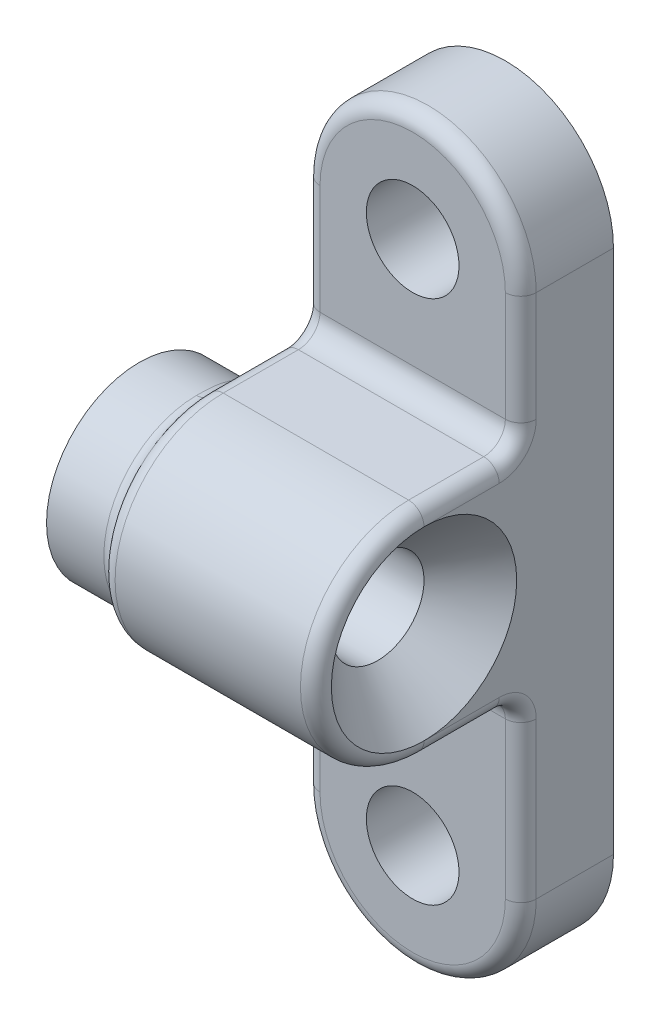
from build123d import *
from build123d.topology import SkipClean

# Parameters (mm, degrees)
SKETCH_1_R      = 1.5
EXTRUDE_1_DEPTH = 3
SKETCH_2_R      = 1.5
EXTRUDE_2_DEPTH = 7
CHAMFER_1_SIZE  = 1.5
FILLET_1_R      = 0.7
FILLET_2_R      = 0.5
SKETCH_3_R      = 3
SKETCH_3_R_2    = 1.5
EXTRUDE_3_DEPTH = 2.22
FILLET_3_R      = 0.5


with BuildPart() as part:
    # 草图1 → 凸台-拉伸1 (new body)
    with BuildSketch(Plane.XY):
        with BuildLine():
            Line((-14.399999999, 4.45), (-14.399999999, -12.55))
            ThreePointArc((-14.399999999, -12.55), (-17.899999999, -16.05), (-21.399999999, -12.55))
            Line((-21.399999999, -12.55), (-21.399999999, 4.45))
            ThreePointArc((-21.399999999, 4.45), (-17.899999999, 7.95), (-14.399999999, 4.45))
        make_face()
        with Locations((-17.899999999, 4.45)):
            Circle(SKETCH_1_R, mode=Mode.SUBTRACT)
        with Locations((-17.899999999, -12.55)):
            Circle(SKETCH_1_R, mode=Mode.SUBTRACT)
    extrude(amount=EXTRUDE_1_DEPTH)

    # 草图2 → 凸台-拉伸2 (add)
    with BuildSketch(Plane(origin=(-14.399999999, 0, 0), x_dir=(0, 0, -1), z_dir=(1, 0, 0))):
        with BuildLine():
            Line((-6.132588308, 0.199416458), (-3, 0.199416458))
            Line((-3, 0.199416458), (-3, -6.800583542))
            Line((-3, -6.800583542), (-6.132588308, -6.800583542))
            ThreePointArc((-6.132588308, -6.800583542), (-9.632588308, -3.300583542), (-6.132588308, 0.199416458))
        make_face()
        with Locations(Location((-6.132588308, -3.300583542, 0), (0, 0, 90))):
            Circle(SKETCH_2_R, mode=Mode.SUBTRACT)
    extrude(amount=-EXTRUDE_2_DEPTH)

    # 倒角1
    chamfer_1_edges = [part.edges().sort_by_distance(p)[0] for p in [
        (-14.399999999, -4.800583542, 6.132588308),
    ]]
    chamfer(chamfer_1_edges, length=CHAMFER_1_SIZE)

    # 圆角1
    fillet_1_edges = [part.edges().sort_by_distance(p)[0] for p in [
        (-17.899999999, -6.800583542, 3),
        (-17.899999999, 0.199416458, 3),
    ]]
    fillet(fillet_1_edges, radius=FILLET_1_R)

    # 圆角2
    fillet_2_edges = [part.edges().sort_by_distance(p)[0] for p in [
        (-17.899999999, -16.05, 3),
        (-14.399999999, -10.025291771, 3),
        (-14.399999999, -3.300583542, 9.632588308),
        (-14.399999999, -6.800583542, 4.916294154),
        (-21.399999999, -3.300583542, 9.632588308),
        (-21.399999999, 0.199416458, 4.916294154),
        (-14.399999999, 2.674708229, 3),
        (-14.399999999, 0.199416458, 4.916294154),
        (-21.399999999, -6.800583542, 4.916294154),
        (-21.399999999, -10.025291771, 3),
        (-14.399999999, 0.404441711, 3.205025253),
        (-21.399999999, 0.404441711, 3.205025253),
        (-14.399999999, -7.005608796, 3.205025253),
        (-21.399999999, -7.005608796, 3.205025253),
        (-17.899999999, 7.95, 3),
        (-21.399999999, 2.674708229, 3),
    ]]
    fillet(fillet_2_edges, radius=FILLET_2_R - 0.0001)  # a hair under: the kernel refuses the full size

    # 草图3 → 凸台-拉伸3 (add)
    with SkipClean():  # the faces are left unmerged after this step: merging them gives an invalid solid
        with BuildSketch(Plane.ZY.offset(21.399999999)):
            with Locations(Location((6.132588308, -3.300583542, 0), (0, 0, 270))):
                Circle(SKETCH_3_R)
            with Locations(Location((6.132588308, -3.300583542, 0), (0, 0, 270))):
                Circle(SKETCH_3_R_2, mode=Mode.SUBTRACT)
        extrude(amount=EXTRUDE_3_DEPTH)
    add(part.part.scale(1), mode=Mode.REPLACE)  # the faces are merged on a copy

    # 圆角3
    fillet_3_edges = [part.edges().sort_by_distance(p)[0] for p in [
        (-21.399999999, -0.300583542, 6.132588308),
        (-21.399999999, -0.300583542, 6.132588308),
    ]]
    fillet(fillet_3_edges, radius=FILLET_3_R)


solid = part.part
